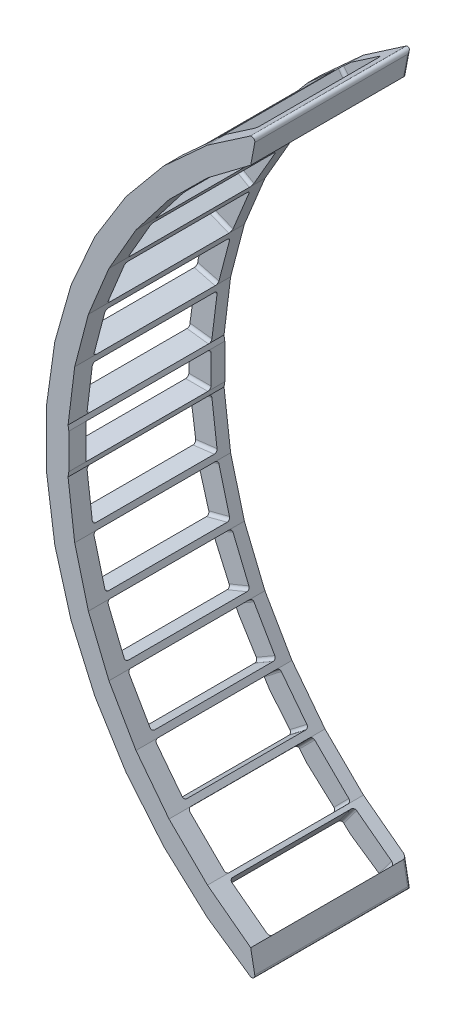
from build123d import *

# Parameters (mm, degrees)
BOSS_EXTRUDE1_START = -50
BOSS_EXTRUDE1_DEPTH = 50
SKETCH2_W           = 17.341707002
SKETCH2_H           = 40
CUT_EXTRUDE1_DEPTH  = 50
SKETCH3_W           = 17.341705661
SKETCH3_H           = 40
CUT_EXTRUDE2_DEPTH  = 50
SKETCH4_W           = 16
SKETCH4_H           = 40
CUT_EXTRUDE3_DEPTH  = 50
SKETCH5_W           = 16
SKETCH5_H           = 40
CUT_EXTRUDE4_DEPTH  = 50
SKETCH6_W           = 40
SKETCH6_H           = 15.34171133
CUT_EXTRUDE5_DEPTH  = 50
SKETCH7_W           = 40
SKETCH7_H           = 15.341734673
CUT_EXTRUDE6_DEPTH  = 50
SKETCH8_W           = 40
SKETCH8_H           = 15.341690595
CUT_EXTRUDE7_DEPTH  = 50
SKETCH9_W           = 40
SKETCH9_H           = 15.341731351
CUT_EXTRUDE8_DEPTH  = 50
SKETCH10_W          = 40
SKETCH10_H          = 15.341687888
CUT_EXTRUDE9_DEPTH  = 50
SKETCH11_W          = 40
SKETCH11_H          = 15.341711331
CUT_EXTRUDE10_DEPTH = 50
SKETCH12_W          = 40
SKETCH12_H          = 15.341721458
CUT_EXTRUDE11_DEPTH = 50
SKETCH13_W          = 40
SKETCH13_H          = 15.341704709
CUT_EXTRUDE12_DEPTH = 50
SKETCH14_W          = 40
SKETCH14_H          = 15.34171659
CUT_EXTRUDE13_DEPTH = 50
SKETCH15_W          = 40
SKETCH15_H          = 15.341710605
CUT_EXTRUDE14_DEPTH = 50
SKETCH16_W          = 40
SKETCH16_H          = 11.249694824
CUT_EXTRUDE15_DEPTH = 50
FILLET1_R           = 1
FILLET2_R           = 1
FILLET3_R           = 1


with BuildPart() as part:
    # Boss-Extrude1: read off the stored shape, not the designer's step
    # Boss-Extrude1 outline → Boss-Extrude1 (new body)
    with BuildSketch(Plane.XY.offset(9420.802742053).offset(BOSS_EXTRUDE1_START)):
        Polygon((64825.857165768, 118355.962801087), (64824.092952206, 118365.292001236), (64810.24682565, 118375.733252037), (64797.916041806, 118387.926960457), (64787.320666745, 118401.655506599), (64778.649806454, 118416.673878181), (64772.058226063, 118432.714008797), (64767.66354604, 118449.489643562), (64765.544228509, 118466.70136689), (64765.781827404, 118468.299084175), (64765.781827404, 118479.548778999), (64765.544228509, 118481.146503914), (64767.66354604, 118498.358204353), (64772.058226063, 118515.133854378), (64778.649806454, 118531.173969734), (64787.320666745, 118546.192356575), (64797.916041806, 118559.920902717), (64810.24682565, 118572.114613045), (64824.092952206, 118582.555866707), (64825.857165768, 118591.885059822), (64810.222148373, 118581.178471077), (64796.216548397, 118568.414173591), (64784.109048321, 118553.837040413), (64774.1319613, 118537.726734627), (64766.476653531, 118520.392338264), (64761.290036395, 118502.166431892), (64758.671634152, 118483.39869355), (64758.671634152, 118464.449177254), (64761.290036395, 118445.681416023), (64766.476653531, 118427.45552491), (64774.1319613, 118410.121147621), (64784.109048321, 118394.010822761), (64796.216548397, 118379.433708656), (64810.222148373, 118366.66939019), align=None)
    extrude(amount=BOSS_EXTRUDE1_DEPTH)

    # Sketch2 → Cut-Extrude1 (cut)
    with BuildSketch(Plane(origin=(-27239.459174809, 27545.66691353, 0), x_dir=(0.7110478710334375, 0.7031436020464213, 0), z_dir=(0.7031436020464213, -0.7110478710334375, 0))):
        with Locations((129447.740944306, 9394.802741576)):
            Rectangle(SKETCH2_W, SKETCH2_H)
    extrude(amount=-CUT_EXTRUDE1_DEPTH, mode=Mode.SUBTRACT)

    # Sketch3 → Cut-Extrude2 (cut)
    with BuildSketch(Plane(origin=(91227.057635221, 92252.585488816, 0), x_dir=(0.7110479260232204, -0.7031435464384759, 0), z_dir=(0.7031435464384759, 0.7110479260232204, 0))):
        with Locations((-37160.612153492, -9394.802741576)):
            Rectangle(SKETCH3_W, SKETCH3_H)
    extrude(amount=-CUT_EXTRUDE2_DEPTH, mode=Mode.SUBTRACT)

    # Sketch4 → Cut-Extrude3 (cut)
    with BuildSketch(Plane(origin=(80400.630754603, 106619.152231039, 0), x_dir=(0.7984290933545077, -0.6020888496601635, 0), z_dir=(0.6020888496601634, 0.7984290933545076, 0))):
        with Locations((-19516.980737355, -9394.802741576)):
            Rectangle(SKETCH4_W, SKETCH4_H)
    extrude(amount=-CUT_EXTRUDE3_DEPTH, mode=Mode.SUBTRACT)

    # Sketch5 → Cut-Extrude4 (cut)
    with BuildSketch(Plane(origin=(-33506.179765582, 44432.481047694, 0), x_dir=(0.7984290140446426, 0.6020889548328386, 0), z_dir=(0.6020889548328386, -0.7984290140446427, 0))):
        with Locations((123146.68374536, 9394.802741576)):
            Rectangle(SKETCH5_W, SKETCH5_H)
    extrude(amount=-CUT_EXTRUDE4_DEPTH, mode=Mode.SUBTRACT)

    # Sketch6 → Cut-Extrude5 (cut)
    with BuildSketch(Plane(origin=(-16735.542493464, 12916.105443837, 0), x_dir=(0, 0, -1), z_dir=(0.791648867916305, -0.6109763251770342, 0))):
        with Locations((-9394.802741576, 133438.14892957)):
            Rectangle(SKETCH6_W, SKETCH6_H)
    extrude(amount=-CUT_EXTRUDE5_DEPTH, mode=Mode.SUBTRACT)

    # Sketch7 → Cut-Extrude6 (cut)
    with BuildSketch(Plane(origin=(-2741.46241872, 1582.782350489, 0), x_dir=(0, 0, -1), z_dir=(0.8660256383670186, -0.4999995936908329, 0))):
        with Locations((-9394.802741576, 135048.005053936)):
            Rectangle(SKETCH7_W, SKETCH7_H)
    extrude(amount=-CUT_EXTRUDE6_DEPTH, mode=Mode.SUBTRACT)

    # Sketch8 → Cut-Extrude7 (cut)
    with BuildSketch(Plane(origin=(13747.446447151, -5649.423112772, 0), x_dir=(0, 0, -1), z_dir=(0.9249453084423641, -0.3801002188771536, 0))):
        with Locations((-9394.802741576, 134247.561392174)):
            Rectangle(SKETCH8_W, SKETCH8_H)
    extrude(amount=-CUT_EXTRUDE7_DEPTH, mode=Mode.SUBTRACT)

    # Sketch9 → Cut-Extrude8 (cut)
    with BuildSketch(Plane(origin=(31559.099816908, -8267.467747216, 0), x_dir=(0, 0, -1), z_dir=(0.9673572773639042, -0.25341645157940046, 0))):
        with Locations((-9394.802741576, 131051.111503258)):
            Rectangle(SKETCH9_W, SKETCH9_H)
    extrude(amount=-CUT_EXTRUDE8_DEPTH, mode=Mode.SUBTRACT)

    # Sketch10 → Cut-Extrude9 (cut)
    with BuildSketch(Plane(origin=(49427.283625952, -6086.098761485, 0), x_dir=(0, 0, -1), z_dir=(0.9925043369629886, -0.1222094149796109, 0))):
        with Locations((-9394.802741576, 125515.681868428)):
            Rectangle(SKETCH10_W, SKETCH10_H)
    extrude(amount=-CUT_EXTRUDE9_DEPTH, mode=Mode.SUBTRACT)

    # Sketch11 → Cut-Extrude10 (cut)
    with BuildSketch(Plane(origin=(97871.088355516, 75534.647149716, 0), x_dir=(0, 0, -1), z_dir=(0.791648867916305, 0.6109763251770342, 0))):
        with Locations((-9394.802741576, 54141.346586517)):
            Rectangle(SKETCH11_W, SKETCH11_H)
    extrude(amount=-CUT_EXTRUDE10_DEPTH, mode=Mode.SUBTRACT)

    # Sketch12 → Cut-Extrude11 (cut)
    with BuildSketch(Plane(origin=(99859.911169091, 57654.14270403, 0), x_dir=(0, 0, -1), z_dir=(0.8660254183950191, 0.49999997469373136, 0))):
        with Locations((-9394.802741576, 70154.855415648)):
            Rectangle(SKETCH12_W, SKETCH12_H)
    extrude(amount=-CUT_EXTRUDE11_DEPTH, mode=Mode.SUBTRACT)

    # Sketch13 → Cut-Extrude12 (cut)
    with BuildSketch(Plane(origin=(97051.641951085, 39882.698921629, 0), x_dir=(0, 0, -1), z_dir=(0.9249454355654468, 0.38009990953254114, 0))):
        with Locations((-9394.802741576, 84916.273919747)):
            Rectangle(SKETCH13_W, SKETCH13_H)
    extrude(amount=-CUT_EXTRUDE12_DEPTH, mode=Mode.SUBTRACT)

    # Sketch14 → Cut-Extrude13 (cut)
    with BuildSketch(Plane(origin=(89645.517882951, 23484.259887241, 0), x_dir=(0, 0, -1), z_dir=(0.9673572208574766, 0.25341666727920537, 0))):
        with Locations((-9394.802741576, 98162.092811989)):
            Rectangle(SKETCH14_W, SKETCH14_H)
    extrude(amount=-CUT_EXTRUDE13_DEPTH, mode=Mode.SUBTRACT)

    # Sketch15 → Cut-Extrude14 (cut)
    with BuildSketch(Plane(origin=(78167.471644153, 9624.933535258, 0), x_dir=(0, 0, -1), z_dir=(0.9925043566749019, 0.12220925489233396, 0))):
        with Locations((-9394.802741576, 109656.097469378)):
            Rectangle(SKETCH15_W, SKETCH15_H)
    extrude(amount=-CUT_EXTRUDE14_DEPTH, mode=Mode.SUBTRACT)

    # Sketch16 → Cut-Extrude15 (cut)
    with BuildSketch(Plane(origin=(64765.781827404, 0, 0), x_dir=(0, 0, -1), z_dir=(1, 0, 0))):
        with Locations((-9395.222684909, 118473.923931587)):
            Rectangle(SKETCH16_W, SKETCH16_H)
    extrude(amount=-CUT_EXTRUDE15_DEPTH, mode=Mode.SUBTRACT)

    # Fillet1
    fillet1_edges = [part.edges().sort_by_distance(p)[0] for p in [
        (64825.857165768, 118355.962801087, 9395.802742053),
        (64824.975058987, 118360.627401162, 9370.802742053),
        (64824.975058987, 118587.220463265, 9370.802742053),
        (64825.857165768, 118591.885059822, 9395.802742053),
    ]]
    fillet(fillet1_edges, radius=FILLET1_R)

    # Fillet2
    fillet2_edges = [part.edges().sort_by_distance(p)[0] for p in [
        (64822.073663965, 118362.614226219, 9414.802741576),
        (64807.883805261, 118373.343667784, 9414.802741576),
        (64809.249939028, 118372.182855382, 9414.802741576),
        (64795.537176626, 118385.521353293, 9414.802741576),
        (64793.998532603, 118387.429889858, 9414.802741576),
        (64784.632517105, 118399.580854749, 9414.802741576),
        (64783.367332189, 118401.682449021, 9414.802741576),
        (64775.69687385, 118414.969001862, 9414.802741576),
        (64774.728977485, 118417.224930432, 9414.802741576),
        (64768.889758125, 118431.41194888, 9414.802741576),
        (64768.237567482, 118433.78060696, 9414.802741576),
        (64764.332868945, 118448.617112639, 9414.802741576),
        (64764.009039099, 118451.054760551, 9414.802741576),
        (64762.10793133, 118466.278248024, 9414.802741576),
        (64762.10793133, 118481.569623342, 9414.802741576),
        (64764.009038601, 118496.793087984, 9414.802741576),
        (64768.237568094, 118514.067255264, 9414.802741576),
        (64764.332868669, 118499.230734555, 9414.802741576),
        (64768.889758723, 118516.435915287, 9414.802741576),
        (64774.728972415, 118530.622920803, 9414.802741576),
        (64775.696867808, 118532.878847809, 9414.802741576),
        (64783.367330169, 118546.165413587, 9414.802741576),
        (64784.632516238, 118548.267009094, 9414.802741576),
        (64793.998529735, 118560.417975529, 9414.802741576),
        (64795.537173239, 118562.32651293, 9414.802741576),
        (64807.883804227, 118574.50419797, 9414.802741576),
        (64809.249939801, 118575.665010785, 9414.802741576),
        (64822.073665316, 118585.233639199, 9414.802741576),
    ]]
    fillet(fillet2_edges, radius=FILLET2_R)

    # Fillet3
    fillet3_edges = [part.edges().sort_by_distance(p)[0] for p in [
        (64807.883804227, 118574.50419797, 9374.802741576),
        (64795.537173239, 118562.32651293, 9374.802741576),
        (64762.226730778, 118479.548778999, 9375.222684909),
        (64762.226730778, 118468.299084175, 9375.222684909),
        (64795.537176626, 118385.521353293, 9374.802741576),
        (64807.883805261, 118373.343667784, 9374.802741576),
        (64822.073665316, 118585.233639199, 9374.802741576),
        (64809.249939801, 118575.665010785, 9374.802741576),
        (64784.632516238, 118548.267009094, 9374.802741576),
        (64793.998529735, 118560.417975529, 9374.802741576),
        (64775.696867808, 118532.878847809, 9374.802741576),
        (64783.367330169, 118546.165413587, 9374.802741576),
        (64768.889758723, 118516.435915287, 9374.802741576),
        (64774.728972415, 118530.622920803, 9374.802741576),
        (64764.332868669, 118499.230734555, 9374.802741576),
        (64768.237568094, 118514.067255264, 9374.802741576),
        (64762.10793133, 118481.569623342, 9374.802741576),
        (64764.009038601, 118496.793087984, 9374.802741576),
        (64762.10793133, 118466.278248024, 9374.802741576),
        (64764.009039099, 118451.054760551, 9374.802741576),
        (64768.237567482, 118433.78060696, 9374.802741576),
        (64764.332868945, 118448.617112639, 9374.802741576),
        (64774.728977485, 118417.224930432, 9374.802741576),
        (64768.889758124, 118431.41194888, 9374.802741576),
        (64783.367332189, 118401.682449021, 9374.802741576),
        (64775.69687385, 118414.969001862, 9374.802741576),
        (64793.998532603, 118387.429889858, 9374.802741576),
        (64784.632517105, 118399.580854749, 9374.802741576),
        (64809.249939028, 118372.182855382, 9374.802741576),
        (64822.073663965, 118362.614226219, 9374.802741576),
    ]]
    fillet(fillet3_edges, radius=FILLET3_R)


solid = part.part
